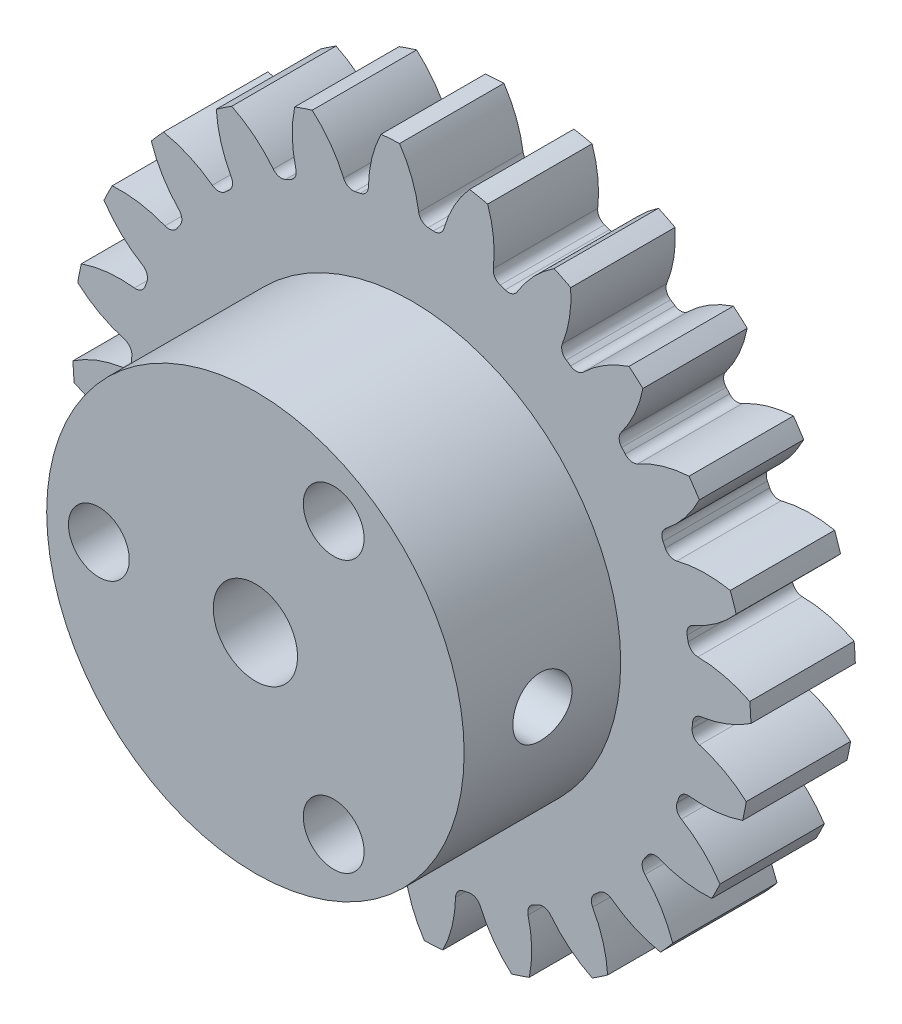
from build123d import *

# Parameters (mm, degrees)
SKETCH3_R           = 20.6375
GEARBODY_DEPTH      = 6.35
TOOTHCUT_DEPTH      = 30.868634259
CIRPATTERN1_COUNT   = 24
HUB2DIA_R           = 12.7
BOSS_EXTRUDE1_DEPTH = 9.525
SKETCH4_R           = 1.849999983
CUT_EXTRUDE1_DEPTH  = 34.206692975
SKETCH5_R           = 2.563499953
CUT_EXTRUDE2_DEPTH  = 34.206692975
SKETCH6_R           = 1.799999956
CUT_EXTRUDE3_DEPTH  = 34.206692975


with BuildPart() as part:
    # Sketch3 → gearBody (new body)
    with BuildSketch(Plane.XY):
        Circle(SKETCH3_R)
    extrude(amount=GEARBODY_DEPTH)

    # Sketch2 → toothCut (cut, through all)
    with BuildSketch(Plane.XY):
        with BuildLine():
            ThreePointArc((17.04439181, -1.303986765), (17.05590718, -1.14354882), (17.065912391, -0.983009622))
            ThreePointArc((17.065912391, -0.983009622), (17.226475942, -0.603092534), (17.591114308, -0.410332293))
            ThreePointArc((17.591114308, -0.410332293), (20.42378314, 0.626979823), (22.599606758, 2.716434472))
            ThreePointArc((22.599606758, 2.716434472), (22.711286815, -1.522725526), (22.034703624, -5.709034773))
            ThreePointArc((22.034703624, -5.709034773), (20.157284273, -3.347822008), (17.488443939, -1.941649751))
            ThreePointArc((17.488443939, -1.941649751), (17.152801577, -1.701937731), (17.04439181, -1.303986765))
        make_face()
    toothcut = extrude(amount=TOOTHCUT_DEPTH, mode=Mode.SUBTRACT)

    # CirPattern1: toothCut ×24 about axis
    cirpattern1_axis = Axis((0, 0, 6.35), (0, 0, -1))
    for i in range(1, CIRPATTERN1_COUNT):
        add(toothcut.rotate(cirpattern1_axis, i * 360 / CIRPATTERN1_COUNT), mode=Mode.SUBTRACT)

    # hub2Dia → Boss-Extrude1 (add)
    with BuildSketch(Plane.XY.offset(6.35)):
        Circle(HUB2DIA_R)
    extrude(amount=BOSS_EXTRUDE1_DEPTH)

    # Sketch4 → Cut-Extrude1 (cut, through all)
    with BuildSketch(Plane(origin=(0, 0, 0), x_dir=(-1, 0, 0), z_dir=(0, 0, -1))):
        with Locations((9.525, 0)):
            Circle(SKETCH4_R)
        with Locations((-4.7625, -8.248891971)):
            Circle(SKETCH4_R)
        with Locations((-4.7625, 8.248891971)):
            Circle(SKETCH4_R)
    extrude(amount=-CUT_EXTRUDE1_DEPTH, mode=Mode.SUBTRACT)

    # Sketch5 → Cut-Extrude2 (cut, through all)
    with BuildSketch(Plane(origin=(0, 0, 0), x_dir=(-1, 0, 0), z_dir=(0, 0, -1))):
        Circle(SKETCH5_R)
    extrude(amount=-CUT_EXTRUDE2_DEPTH, mode=Mode.SUBTRACT)

    # Sketch6 → Cut-Extrude3 (cut, through all)
    with BuildSketch(Plane(origin=(0, 0, 0), x_dir=(0, 0, -1), z_dir=(1, 0, 0))):
        with Locations((-11.1125, 0)):
            Circle(SKETCH6_R)
    extrude(amount=CUT_EXTRUDE3_DEPTH, mode=Mode.SUBTRACT)


solid = part.part
